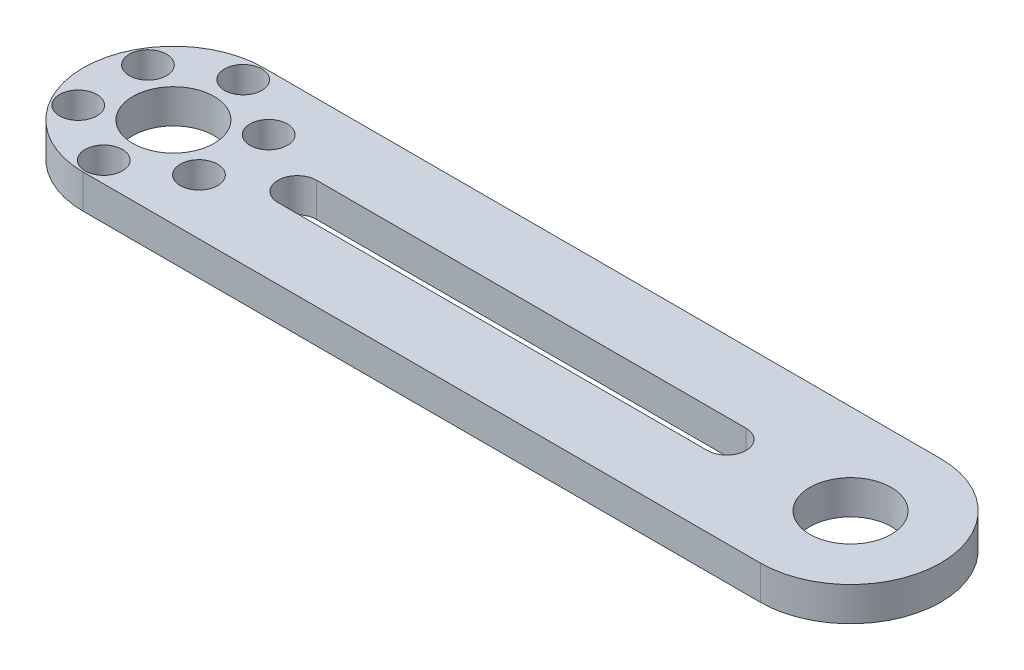
from build123d import *

# Parameters (mm, degrees)
BOSS_EXTRUDE1_DEPTH = 2.56
CUT_EXTRUDE1_REACH  = 68.214
SKETCH2_R           = 6.13
SKETCH2_R_2         = 2.81


with BuildPart() as part:
    # Sketch1 → Boss-Extrude1 (new, symmetric)
    with BuildSketch(Plane(origin=(0, 0, 0), x_dir=(1, 0, 0), z_dir=(0, 1, 0))):
        with BuildLine():
            Line((51, -13.6), (-51, -13.6))
            ThreePointArc((-51, -13.6), (-64.6, 0), (-51, 13.6))
            Line((-51, 13.6), (51, 13.6))
            ThreePointArc((51, 13.6), (64.6, 0), (51, -13.6))
        make_face()
        with BuildLine():
            Line((32.35, -2.91), (-32.35, -2.91))
            ThreePointArc((-32.35, -2.91), (-35.26, 0), (-32.35, 2.91))
            Line((-32.35, 2.91), (32.35, 2.91))
            ThreePointArc((32.35, 2.91), (35.26, 0), (32.35, -2.91))
        make_face(mode=Mode.SUBTRACT)
    extrude(amount=BOSS_EXTRUDE1_DEPTH, both=True)

    # Sketch2 → Cut-Extrude1 (cut, up to next)
    with BuildSketch(Plane(origin=(0, 2.56, 0), x_dir=(1, 0, 0), z_dir=(0, 1, 0)), mode=Mode.PRIVATE) as cut_extrude1_sk1:
        with Locations((-51, 0)):
            Circle(SKETCH2_R)
    cut_extrude1_tool1 = extrude(cut_extrude1_sk1.sketch, amount=-CUT_EXTRUDE1_REACH, mode=Mode.PRIVATE) & part.part
    # Sketch2 → Cut-Extrude1 (cut, up to next)
    with BuildSketch(Plane(origin=(0, 2.56, 0), x_dir=(1, 0, 0), z_dir=(0, 1, 0)), mode=Mode.PRIVATE) as cut_extrude1_sk2:
        with Locations((-51, 10.5)):
            Circle(SKETCH2_R_2)
    cut_extrude1_tool2 = extrude(cut_extrude1_sk2.sketch, amount=-CUT_EXTRUDE1_REACH, mode=Mode.PRIVATE) & part.part
    # Sketch2 → Cut-Extrude1 (cut, up to next)
    with BuildSketch(Plane(origin=(0, 2.56, 0), x_dir=(1, 0, 0), z_dir=(0, 1, 0)), mode=Mode.PRIVATE) as cut_extrude1_sk3:
        with Locations((-41.90673326, 5.25)):
            Circle(SKETCH2_R_2)
    cut_extrude1_tool3 = extrude(cut_extrude1_sk3.sketch, amount=-CUT_EXTRUDE1_REACH, mode=Mode.PRIVATE) & part.part
    # Sketch2 → Cut-Extrude1 (cut, up to next)
    with BuildSketch(Plane(origin=(0, 2.56, 0), x_dir=(1, 0, 0), z_dir=(0, 1, 0)), mode=Mode.PRIVATE) as cut_extrude1_sk4:
        with Locations((-41.90673326, -5.25)):
            Circle(SKETCH2_R_2)
    cut_extrude1_tool4 = extrude(cut_extrude1_sk4.sketch, amount=-CUT_EXTRUDE1_REACH, mode=Mode.PRIVATE) & part.part
    # Sketch2 → Cut-Extrude1 (cut, up to next)
    with BuildSketch(Plane(origin=(0, 2.56, 0), x_dir=(1, 0, 0), z_dir=(0, 1, 0)), mode=Mode.PRIVATE) as cut_extrude1_sk5:
        with Locations((-51, -10.5)):
            Circle(SKETCH2_R_2)
    cut_extrude1_tool5 = extrude(cut_extrude1_sk5.sketch, amount=-CUT_EXTRUDE1_REACH, mode=Mode.PRIVATE) & part.part
    # Sketch2 → Cut-Extrude1 (cut, up to next)
    with BuildSketch(Plane(origin=(0, 2.56, 0), x_dir=(1, 0, 0), z_dir=(0, 1, 0)), mode=Mode.PRIVATE) as cut_extrude1_sk6:
        with Locations((-60.09326674, -5.25)):
            Circle(SKETCH2_R_2)
    cut_extrude1_tool6 = extrude(cut_extrude1_sk6.sketch, amount=-CUT_EXTRUDE1_REACH, mode=Mode.PRIVATE) & part.part
    # Sketch2 → Cut-Extrude1 (cut, up to next)
    with BuildSketch(Plane(origin=(0, 2.56, 0), x_dir=(1, 0, 0), z_dir=(0, 1, 0)), mode=Mode.PRIVATE) as cut_extrude1_sk7:
        with Locations((-60.09326674, 5.25)):
            Circle(SKETCH2_R_2)
    cut_extrude1_tool7 = extrude(cut_extrude1_sk7.sketch, amount=-CUT_EXTRUDE1_REACH, mode=Mode.PRIVATE) & part.part
    # Sketch2 → Cut-Extrude1 (cut, up to next)
    with BuildSketch(Plane(origin=(0, 2.56, 0), x_dir=(1, 0, 0), z_dir=(0, 1, 0)), mode=Mode.PRIVATE) as cut_extrude1_sk8:
        with Locations((51, 0)):
            Circle(SKETCH2_R)
    cut_extrude1_tool8 = extrude(cut_extrude1_sk8.sketch, amount=-CUT_EXTRUDE1_REACH, mode=Mode.PRIVATE) & part.part
    add(cut_extrude1_tool1.solids().sort_by_distance((-51, 2.56, 0))[0], mode=Mode.SUBTRACT)
    add(cut_extrude1_tool2.solids().sort_by_distance((-51, 2.56, -10.5))[0], mode=Mode.SUBTRACT)
    add(cut_extrude1_tool3.solids().sort_by_distance((-41.906733, 2.56, -5.25))[0], mode=Mode.SUBTRACT)
    add(cut_extrude1_tool4.solids().sort_by_distance((-41.906733, 2.56, 5.25))[0], mode=Mode.SUBTRACT)
    add(cut_extrude1_tool5.solids().sort_by_distance((-51, 2.56, 10.5))[0], mode=Mode.SUBTRACT)
    add(cut_extrude1_tool6.solids().sort_by_distance((-60.093267, 2.56, 5.25))[0], mode=Mode.SUBTRACT)
    add(cut_extrude1_tool7.solids().sort_by_distance((-60.093267, 2.56, -5.25))[0], mode=Mode.SUBTRACT)
    add(cut_extrude1_tool8.solids().sort_by_distance((51, 2.56, 0))[0], mode=Mode.SUBTRACT)


solid = part.part
